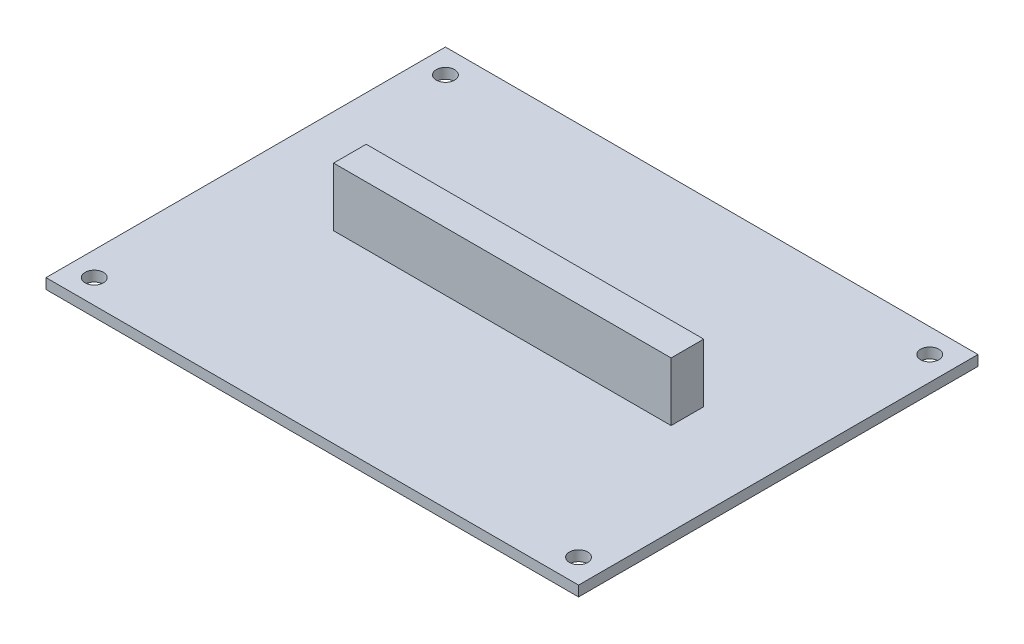
from build123d import *

# Parameters (mm, degrees)
SKETCH1_W           = 80
SKETCH1_H           = 60
SKETCH1_R           = 1.375
BOSS_EXTRUDE1_DEPTH = 1.55
SKETCH2_W           = 50.7
SKETCH2_H           = 4.9
BOSS_EXTRUDE2_DEPTH = 8.8


with BuildPart() as part:
    # Sketch1 → Boss-Extrude1 (new body)
    with BuildSketch(Plane(origin=(0, 0, 0), x_dir=(1, 0, 0), z_dir=(0, 1, 0))):
        Rectangle(SKETCH1_W, SKETCH1_H)
        with Locations((-36.375, 26.375)):
            Circle(SKETCH1_R, mode=Mode.SUBTRACT)
        with Locations((-36.375, -26.375)):
            Circle(SKETCH1_R, mode=Mode.SUBTRACT)
        with Locations((36.375, -26.375)):
            Circle(SKETCH1_R, mode=Mode.SUBTRACT)
        with Locations((36.375, 26.375)):
            Circle(SKETCH1_R, mode=Mode.SUBTRACT)
    extrude(amount=BOSS_EXTRUDE1_DEPTH)

    # Sketch2 → Boss-Extrude2 (add)
    with BuildSketch(Plane(origin=(0, 1.55, 0), x_dir=(1, 0, 0), z_dir=(0, 1, 0))):
        with Locations((0.85, 0.15)):
            Rectangle(SKETCH2_W, SKETCH2_H)
    extrude(amount=BOSS_EXTRUDE2_DEPTH)


solid = part.part
